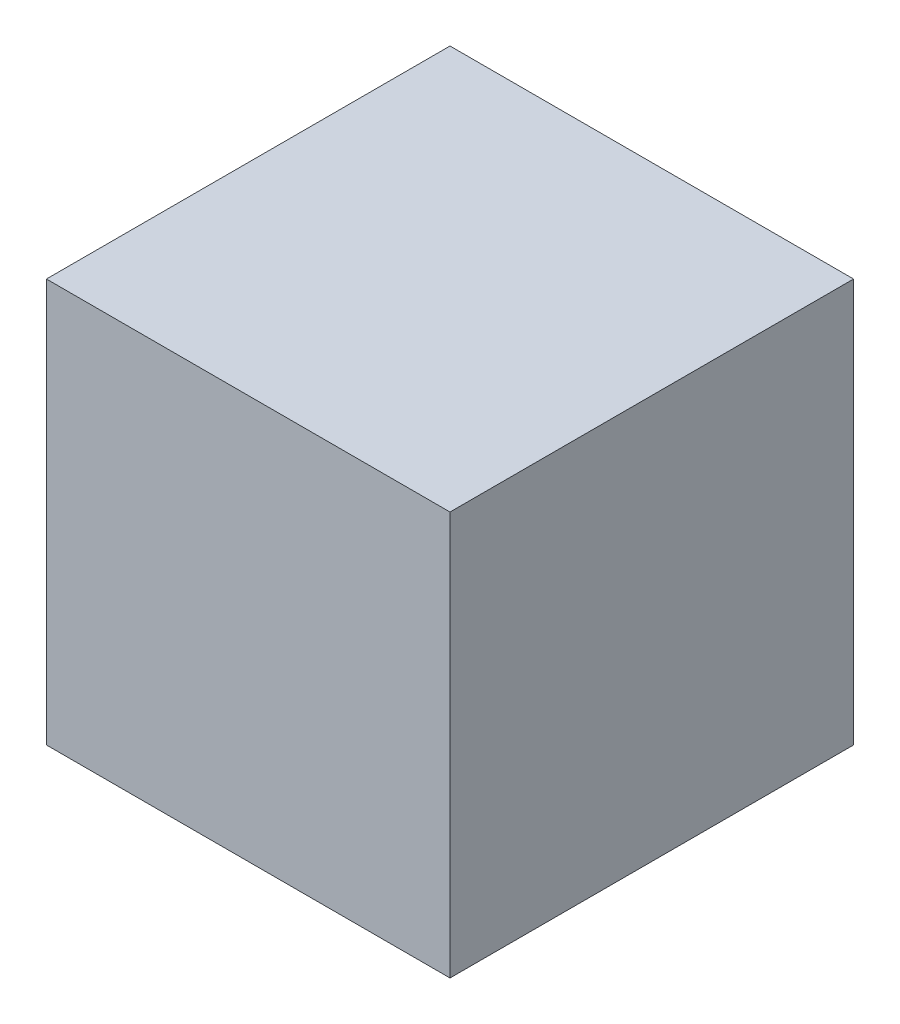
from build123d import *

# Parameters (mm, degrees)
BOSS_EXTRUDE1_DEPTH      = 10
BOSS_EXTRUDE1_DEPTH_BACK = 10
SKETCH1_W                = 20
SKETCH1_H                = 20


with BuildPart() as part:
    # Sketch1 → Boss-Extrude1 (new, two sides: drawn at the far end of the back side and taken through both)
    with BuildSketch(Plane(origin=(0, 0, 0), x_dir=(1, 0, 0), z_dir=(0, 1, 0)).offset(-BOSS_EXTRUDE1_DEPTH_BACK)):
        Rectangle(SKETCH1_W, SKETCH1_H)
    extrude(amount=BOSS_EXTRUDE1_DEPTH + BOSS_EXTRUDE1_DEPTH_BACK)


solid = part.part
